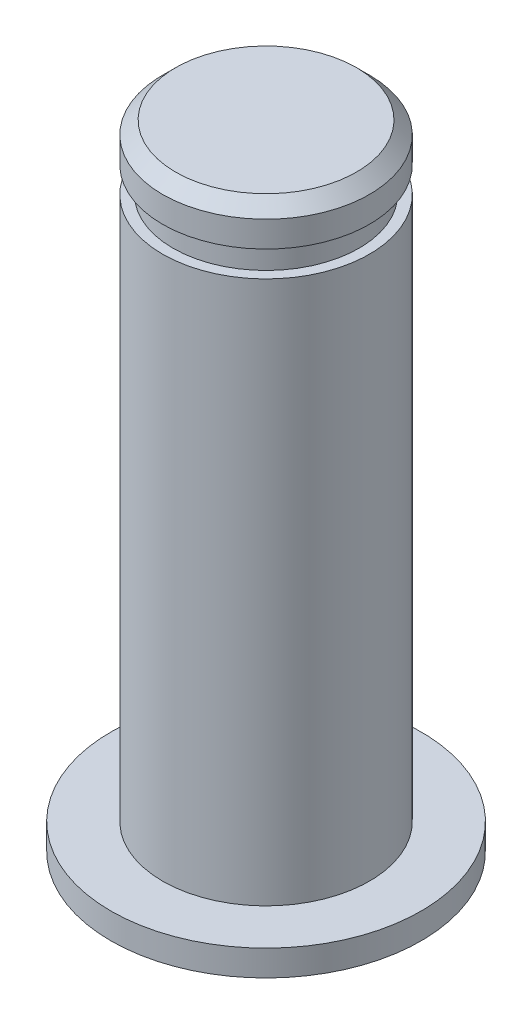
from build123d import *

# Parameters (mm, degrees)
CHAMFER_1_SIZE = 0.5


with BuildPart() as part:
    # Эскиз1 → Повернуть1 (revolve)
    with BuildSketch(Plane.XY):
        Polygon((-4, 24.5), (0, 24.5), (0, 0), (-6, 0), (-6, 1), (-4, 1), (-4, 22), (-3.6, 22), (-3.6, 23), (-4, 23), align=None)
    revolve(axis=Axis((0, 0, 0), (0, -1, 0)))

    # Фаска1
    chamfer_1_edges = [part.edges().sort_by_distance(p)[0] for p in [
        (4, 24.5, 0),
    ]]
    chamfer(chamfer_1_edges, length=CHAMFER_1_SIZE)


solid = part.part
